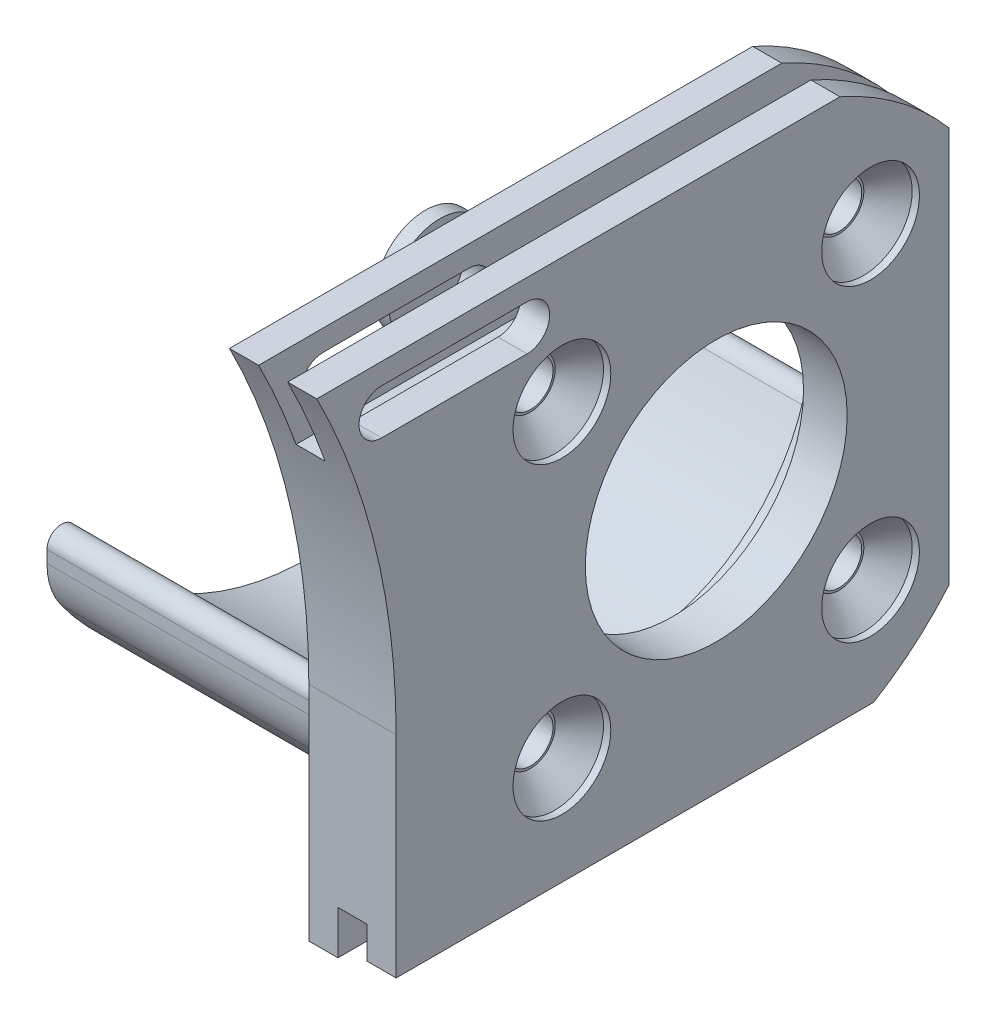
from build123d import *

# Parameters (mm, degrees)
DODANIE_WYCI_GNI_CIE1_START = 27.457167
DODANIE_WYCI_GNI_CIE1_DEPTH = 43.457167
SZKIC2_OUTSIDE_W            = 57.065
SZKIC2_OUTSIDE_H            = 51.608
WYTNIJ_WYCI_GNI_CIE1_DEPTH  = 35.037273975
SZKIC2_4_R                  = 12.5
SZKIC2_4_R_2                = 9
WYTNIJ_WYCI_GNI_CIE2_DEPTH  = 3
SZKIC2_5_R                  = 9
WYTNIJ_WYCI_GNI_CIE3_DEPTH  = 35.037274287
SFAZOWANIE1_SIZE            = 2
DODANIE_WYCI_GNI_CIE2_START = 22
DODANIE_WYCI_GNI_CIE2_DEPTH = 22
ZAOKR_GLENIE1_START         = -22
ZAOKR_GLENIE1_DEPTH         = 22
WYTNIJ_WYCI_GNI_CIE4_DEPTH  = 45.484784375
SZKIC8_R                    = 3.5
DODANIE_WYCI_GNI_CIE3_DEPTH = 1


with BuildPart() as part:
    # Szkic1 → Dodanie-wyciągnięcie1 (new body)
    with BuildSketch(Plane.XY.offset(DODANIE_WYCI_GNI_CIE1_START)):
        Polygon((4, 13.2), (2, 13.2), (2, 19.2), (0, 19.2), (0, -18.8), (2, -18.8), (2, -15.8), (4, -15.8), (4, -18), (6, -18), (6, 19.2), (4, 19.2), align=None)
    extrude(amount=-DODANIE_WYCI_GNI_CIE1_DEPTH)

    # Szkic2 outside → Wytnij-wyciągnięcie1 (cut, through all)
    with BuildSketch(Plane(origin=(0, 0, 0), x_dir=(0, 0, -1), z_dir=(1, 0, 0))):
        with Locations((-5.7285, 0.2)):
            Rectangle(SZKIC2_OUTSIDE_W, SZKIC2_OUTSIDE_H)
        with BuildLine():
            Line((-22, -18.8), (-22, -3.514226))
            ThreePointArc((-22, -3.514226), (-23.38343065, 8.166064436), (-27.457167387, 19.2))
            Line((-27.457167387, 19.2), (8.506468127, 19.2))
            ThreePointArc((8.506468127, 19.2), (12.568915153, 16.823268763), (16, 13.601470509))
            Line((16, 13.601470509), (16, -13.601470509))
            ThreePointArc((16, -13.601470509), (12.942371407, -16.537684915), (9.357350052, -18.8))
            Line((9.357350052, -18.8), (-22, -18.8))
        make_face(mode=Mode.SUBTRACT)
    extrude(amount=WYTNIJ_WYCI_GNI_CIE1_DEPTH, mode=Mode.SUBTRACT)

    # Szkic2<4> → Wytnij-wyciągnięcie2 (cut)
    with BuildSketch(Plane(origin=(0, 0, 0), x_dir=(0, 0, -1), z_dir=(1, 0, 0))):
        Circle(SZKIC2_4_R)
        Circle(SZKIC2_4_R_2, mode=Mode.SUBTRACT)
    extrude(amount=WYTNIJ_WYCI_GNI_CIE2_DEPTH, mode=Mode.SUBTRACT)

    # Szkic2<5> → Wytnij-wyciągnięcie3 (cut, through all)
    with BuildSketch(Plane(origin=(0, 0, 0), x_dir=(0, 0, -1), z_dir=(1, 0, 0))):
        with Locations(Location((0, 0, 0), (0, 0, 180))):
            Circle(SZKIC2_5_R)
    extrude(amount=WYTNIJ_WYCI_GNI_CIE3_DEPTH, mode=Mode.SUBTRACT)

    # Sfazowanie1
    # the kernel refuses this chamfer: 2 mm, written as the material it takes off along each edge
    with BuildSketch(Plane(origin=(4, 13.2, -16), x_dir=(0, 0, 1), z_dir=(-1, 0, 0))) as sfazowanie1_piece_1:
        Polygon((SFAZOWANIE1_SIZE, 0), (0, -SFAZOWANIE1_SIZE), (0, 0), align=None)
    extrude(amount=2, mode=Mode.SUBTRACT)
    with BuildSketch(Plane(origin=(4, -15.8, -13.833293173), x_dir=(0, 0, 1), z_dir=(-1, 0, 0))) as sfazowanie1_piece_2:
        with BuildLine():
            Line((0.773430999, 0), (-0.601291335, 0.547368421))
            ThreePointArc((-0.601291335, 0.547368421), (-0.33094721, 0.295991022), (0, 0))
            Line((0, 0), (0.773430999, 0))
        make_face()
    extrude(amount=2, mode=Mode.SUBTRACT)

    # Szkic3 → Dodanie-wyciągnięcie2 (add)
    with BuildSketch(Plane.ZY.offset(DODANIE_WYCI_GNI_CIE2_START)):
        with BuildLine():
            Line((-18, -10.816653826), (-18, 0))
            ThreePointArc((-18, 0), (0, -18), (18, 0))
            Line((18, 0), (18, -10.816653826))
            ThreePointArc((18, -10.816653826), (0, -21), (-18, -10.816653826))
        make_face()
    extrude(amount=-DODANIE_WYCI_GNI_CIE2_DEPTH)

    # Zaokrąglenie1: read off the stored shape, not the designer's step
    # Zaokrąglenie1 outline → Zaokrąglenie1 (cut)
    with BuildSketch(Plane.YZ.offset(ZAOKR_GLENIE1_START)):
        with BuildLine():
            Line((-10.816653826, -18), (-9.327379053, -18))
            ThreePointArc((-9.327379053, -18), (-10.858310142, -17.759858191), (-12.242185007, -17.0625))
            ThreePointArc((-12.242185007, -17.0625), (-11.538944434, -17.545733423), (-10.816653826, -18))
        make_face()
        with BuildLine():
            ThreePointArc((-8.038687618, -16.105263158), (-7.511952847, -17.229415734), (-8.485281374, -18))
            Line((-8.485281374, -18), (0, -18))
            ThreePointArc((0, -18), (-4.12948321, -17.519913482), (-8.038687618, -16.105263158))
        make_face()
        with BuildLine():
            ThreePointArc((-10.816653826, 18), (-11.538944434, 17.545733423), (-12.242185007, 17.0625))
            ThreePointArc((-12.242185007, 17.0625), (-10.858310142, 17.759858191), (-9.327379053, 18))
            Line((-9.327379053, 18), (-10.816653826, 18))
        make_face()
        with BuildLine():
            ThreePointArc((-8.485281374, 18), (-7.511952847, 17.229415734), (-8.038687618, 16.105263158))
            ThreePointArc((-8.038687618, 16.105263158), (-4.12948321, 17.519913482), (0, 18))
            Line((0, 18), (-8.485281374, 18))
        make_face()
    extrude(amount=ZAOKR_GLENIE1_DEPTH, mode=Mode.SUBTRACT)

    # ZaawansowanyOtwór1: read off the stored shape, not the designer's step
    # ZaawansowanyOtwór1 outline → ZaawansowanyOtwór1 (revolve, cut)
    with BuildSketch(Plane(origin=(0, -10.606601718, 10.606601718), x_dir=(0, 1, 0), z_dir=(0, 0, -1))):
        Polygon((1.7, 3.84), (3.36, 5.5), (3.36, 6), (0, 6), (0, 0), (1.55, 0), (1.55, 3.84), align=None)
    revolve(axis=Axis((0, -10.606601718, 10.606601718), (1, 0, 0)), mode=Mode.SUBTRACT)

    # ZaawansowanyOtw_r1 2 outline → ZaawansowanyOtw_r1 2 (revolve, cut)
    with BuildSketch(Plane(origin=(0, -10.606601718, -10.606601718), x_dir=(0, 1, 0), z_dir=(0, 0, -1))):
        Polygon((3.36, 6), (0, 6), (0, 0), (1.55, 0), (1.55, 3.84), (1.7, 3.84), (3.36, 5.5), align=None)
    revolve(axis=Axis((0, -10.606601718, -10.606601718), (1, 0, 0)), mode=Mode.SUBTRACT)

    # ZaawansowanyOtw_r1 3 outline → ZaawansowanyOtw_r1 3 (revolve, cut)
    with BuildSketch(Plane(origin=(0, 10.606601718, -10.606601718), x_dir=(0, 1, 0), z_dir=(0, 0, -1))):
        Polygon((3.36, 6), (0, 6), (0, 0), (1.55, 0), (1.55, 3.84), (1.7, 3.84), (3.36, 5.5), align=None)
    revolve(axis=Axis((0, 10.606601718, -10.606601718), (1, 0, 0)), mode=Mode.SUBTRACT)

    # ZaawansowanyOtw_r1 4 outline → ZaawansowanyOtw_r1 4 (revolve, cut)
    with BuildSketch(Plane(origin=(0, 10.606601718, 10.606601718), x_dir=(0, 1, 0), z_dir=(0, 0, -1))):
        Polygon((3.36, 6), (0, 6), (0, 0), (1.55, 0), (1.55, 3.84), (1.7, 3.84), (3.36, 5.5), align=None)
    revolve(axis=Axis((0, 10.606601718, 10.606601718), (1, 0, 0)), mode=Mode.SUBTRACT)

    # Szkic7 → Wytnij-wyciągnięcie4 (cut, through all)
    with BuildSketch(Plane(origin=(6, 0, 0), x_dir=(0, 0, -1), z_dir=(1, 0, 0))):
        with BuildLine():
            Line((-23, 17.75), (-13, 17.75))
            ThreePointArc((-13, 17.75), (-11.45, 16.2), (-13, 14.65))
            Line((-13, 14.65), (-23, 14.65))
            ThreePointArc((-23, 14.65), (-24.55, 16.2), (-23, 17.75))
        make_face()
    extrude(amount=-WYTNIJ_WYCI_GNI_CIE4_DEPTH, mode=Mode.SUBTRACT)

    # Szkic8 → Dodanie-wyciągnięcie3 (add)
    with BuildSketch(Plane.ZY):
        with Locations(Location((13, 16.2, 0), (0, 0, 58.997280866))):
            Circle(SZKIC8_R)
    extrude(amount=DODANIE_WYCI_GNI_CIE3_DEPTH)


solid = part.part
